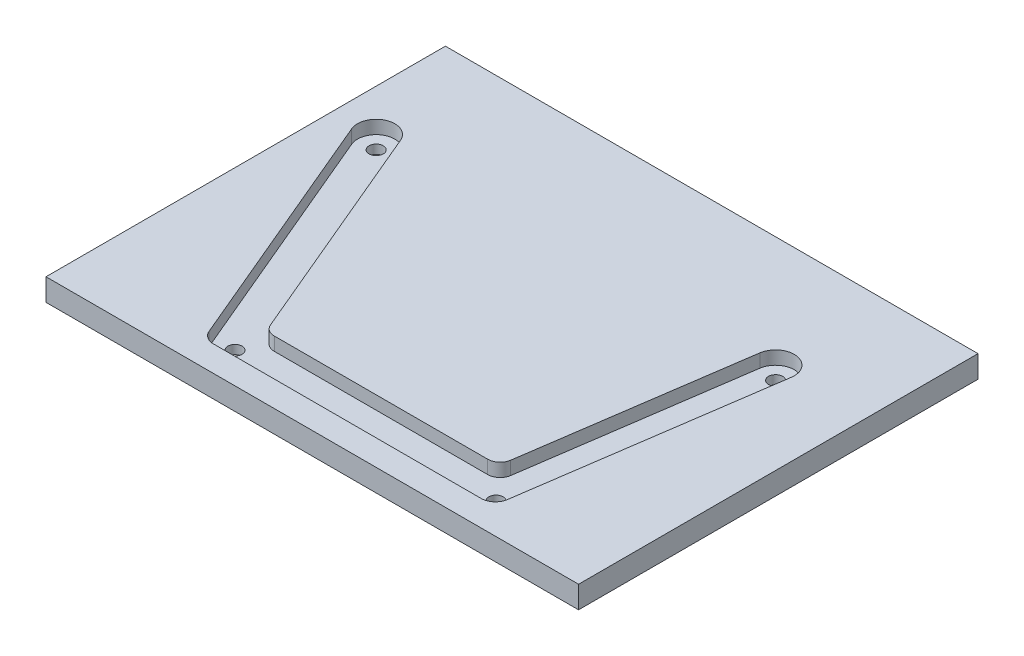
from build123d import *

# Parameters (mm, degrees)
SKETCH1_W           = 120
SKETCH1_H           = 90
BOSS_EXTRUDE1_DEPTH = 5
CUT_EXTRUDE2_DEPTH  = 3
SKETCH3_R           = 1.6
CUT_EXTRUDE3_DEPTH  = 76.059976019


with BuildPart() as part:
    # Sketch1 → Boss-Extrude1 (new body)
    with BuildSketch(Plane(origin=(0, 0, 0), x_dir=(1, 0, 0), z_dir=(0, 1, 0))):
        Rectangle(SKETCH1_W, SKETCH1_H)
    extrude(amount=BOSS_EXTRUDE1_DEPTH)

    # Sketch2 → Cut-Extrude2 (cut)
    with BuildSketch(Plane(origin=(0, 5, 0), x_dir=(1, 0, 0), z_dir=(0, 1, 0))):
        with BuildLine():
            Line((-54.439539518, 18.328736299), (-30.981663531, -37.282607638))
            ThreePointArc((-30.981663531, -37.282607638), (-29.802441703, -38.70535138), (-28.033238223, -39.238908236))
            Line((-28.033238223, -39.238908236), (32.295337297, -39.238908236))
            ThreePointArc((32.295337297, -39.238908236), (34.38890554, -38.459026417), (35.462013903, -36.499515742))
            Line((35.462013903, -36.499515742), (43.586531743, 19.356544412))
            ThreePointArc((43.586531743, 19.356544412), (40.03481605, 24.117354809), (35.274005653, 20.565639116))
            Line((35.274005653, 20.565639116), (28.145630538, -28.441939804))
            ThreePointArc((28.145630538, -28.441939804), (27.206660721, -30.156511644), (25.374788508, -30.838908236))
            Line((25.374788508, -30.838908236), (-22.725182856, -30.838908236))
            ThreePointArc((-22.725182856, -30.838908236), (-24.273235901, -30.372045987), (-25.305055, -29.127145213))
            Line((-25.305055, -29.127145213), (-46.699923085, 21.59344723))
            ThreePointArc((-46.699923085, 21.59344723), (-52.202086768, 23.830899981), (-54.439539518, 18.328736299))
        make_face()
    extrude(amount=-CUT_EXTRUDE2_DEPTH, mode=Mode.SUBTRACT)

    # Sketch3 → Cut-Extrude3 (cut, through all)
    with BuildSketch(Plane(origin=(0, 2, 0), x_dir=(1, 0, 0), z_dir=(0, 1, 0))):
        with Locations((-50.569731302, 19.961091764)):
            Circle(SKETCH3_R)
        with Locations((-27.369731302, -35.038908236)):
            Circle(SKETCH3_R)
        with Locations((31.430268698, -35.038908236)):
            Circle(SKETCH3_R)
        with Locations((39.430268698, 19.961091764)):
            Circle(SKETCH3_R)
    extrude(amount=-CUT_EXTRUDE3_DEPTH, mode=Mode.SUBTRACT)


solid = part.part
